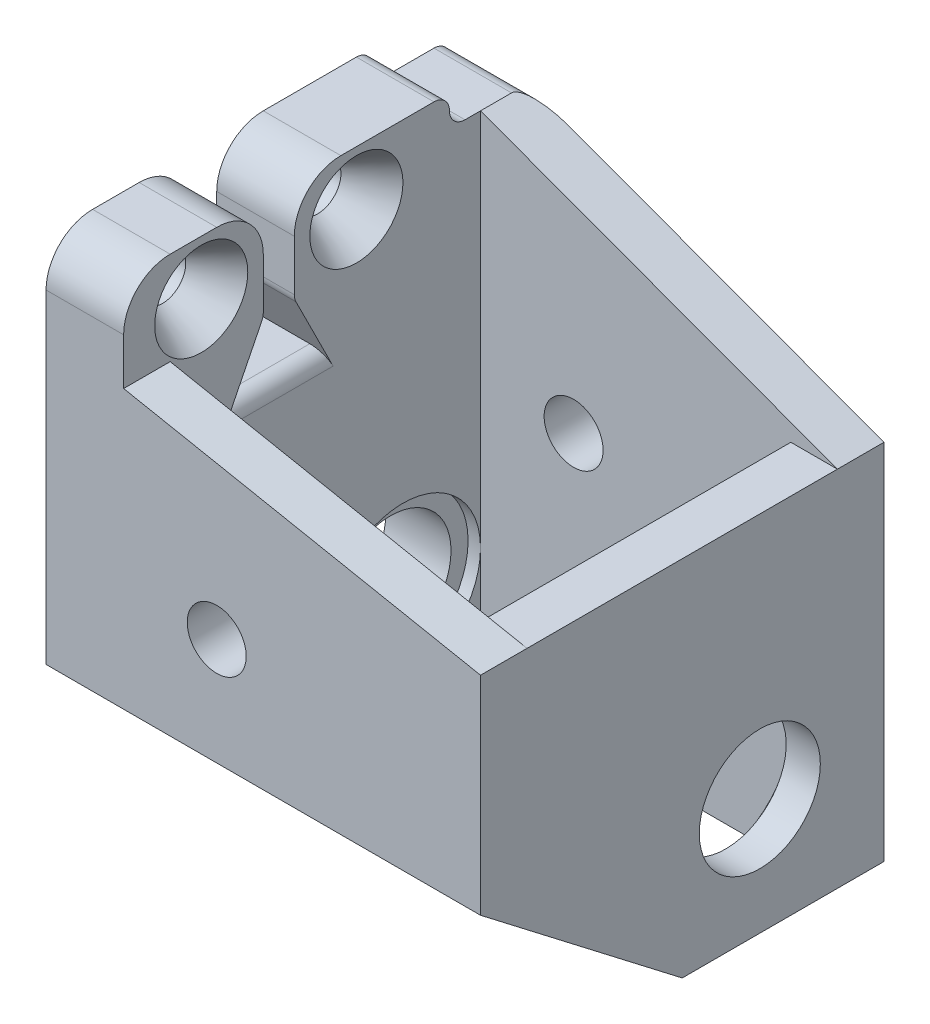
from build123d import *
from build123d.topology import SkipClean

# Parameters (mm, degrees)
SKETCH_1_W                = 20
SKETCH_1_H                = 57.76596942167697
EXTRUDE_1_DEPTH           = 3
EXTRUDE_2_DEPTH           = 3
CUT_EXTRUDE_1_DEPTH       = 6
SKETCH_8_R                = 4.48
CUT_EXTRUDE_2_DEPTH       = 0.8
SKETCH_9_R                = 1.9
CUT_EXTRUDE_3_DEPTH       = 3.8
SKETCH_12_W               = 26.000000000000007
SKETCH_12_H               = 35.36596942167698
CUT_EXTRUDE_4_DEPTH       = 36.00000000000001
CUT_EXTRUDE_8_DEPTH       = 28.00000000000001
SKETCH_23_W               = 26.000000000000004
SKETCH_23_H               = 26
SKETCH_23_W_2             = 20
SKETCH_23_H_2             = 19.999999999999993
EXTRUDE_7_DEPTH           = 4
SKETCH_24_W               = 20
SKETCH_24_H               = 19.999999999999993
EXTRUDE_8_DEPTH           = 3
SKETCH_25_W               = 5.000000000000002
SKETCH_25_H               = 16
SKETCH_25_R               = 1.4999999999999991
EXTRUDE_9_DEPTH           = 3
FILLET_1_R                = 1
CUT_EXTRUDE_9_DEPTH       = 3
SKETCH_27_R               = 1.4999999999999987
CUT_EXTRUDE_10_DEPTH      = 3
SKETCH_28_W               = 20
SKETCH_28_H               = 19.999999999999993
CUT_EXTRUDE_11_DEPTH      = 10
CUT_EXTRUDE_12_DEPTH      = 42.00000000000001
SKETCH_31_R               = 4.48
SKETCH_31_R_2             = 3.98
EXTRUDE_13_DEPTH          = 0.8
SKETCH_32_R               = 5.000000000000001
SKETCH_32_R_2             = 3.98
CUT_EXTRUDE_13_DEPTH      = 0.8
SKETCH_33_R               = 4.48
EXTRUDE_14_DEPTH          = 3
SKETCH_36_R               = 5.000000000000001
CUT_EXTRUDE_14_DEPTH      = 3
SKETCH_37_R               = 3.98
SKETCH_37_R_2             = 3.900000000000001
EXTRUDE_17_DEPTH          = 0.8
SKETCH_38_R               = 1.5000000000000009
EXTRUDE_18_DEPTH          = 3
SKETCH_39_W               = 4.187599959799879
SKETCH_39_H               = 1.3608825238343043
EXTRUDE_19_DEPTH          = 3
EXTRUDE_START             = 2
SKETCH_43_R               = 1.5000000000000024
SKETCH_43_R_2             = 1.5000000000000009
SKETCH_43_R_3             = 3.900000000000002
EXTRUDE_22_DEPTH          = 2
SKETCH_44_W               = 5
SKETCH_44_H               = 9.399224841629362
EXTRUDE_23_DEPTH          = 2
EXTRUDE_24_DEPTH          = 3
SKETCH_47_W               = 5
SKETCH_47_H               = 9.399224841629362
EXTRUDE_25_DEPTH          = 8
SKETCH_51_W               = 5
SKETCH_51_H               = 14
SKETCH_51_H_2             = 7.999999999999998
EXTRUDE_28_DEPTH          = 1.1
CUT_EXTRUDE_16_DEPTH      = 6.1000000000000005
FILLET_START              = -16
FILLET_9_DEPTH            = 7
FILLET_START_2            = -15
FILLET_9_2_DEPTH          = 5
EXTRUDE_30_DEPTH          = 3
FILLET_10_R               = 1
SKETCH_57_W               = 5
SKETCH_57_H               = 10.499224841629362
EXTRUDE_31_DEPTH          = 1
SKETCH_58_W               = 5
SKETCH_58_H               = 10.499224841629362
EXTRUDE_32_DEPTH          = 1
FILLET_11_R               = 3
CUT_EXTRUDE_19_DEPTH      = 6.500000000000001
FILLET_14_R               = 1
FILLET_19_R               = 1
HOLE_WIZARD_1_D           = 3
HOLE_WIZARD_1_DEPTH       = 5
HOLE_WIZARD_1_CSINK_D     = 6
HOLE_WIZARD_1_CSINK_ANGLE = 62


with BuildPart() as part:
    # 草图1 → 凸台-拉伸1 (new body)
    with BuildSketch(Plane.XY):
        with Locations((0, -28.882984710838485)):
            Rectangle(SKETCH_1_W, SKETCH_1_H)
    extrude_1 = extrude(amount=-EXTRUDE_1_DEPTH)

    # 草图2 → 凸台-拉伸2 (add)
    with BuildSketch(Plane.ZY.offset(10)):
        Polygon((-3, -1.22e-15), (23, 0), (23.000000000000007, -57.76596942167697), (-3, -57.76596942167697), align=None)
    extrude_2 = extrude(amount=EXTRUDE_2_DEPTH)

    # 草图7 → 切除-拉伸1 (cut)
    with BuildSketch(Plane(origin=(-10, 0, 0), x_dir=(0, 0, -1), z_dir=(1, 0, 0))):
        with BuildLine():
            ThreePointArc((-1.0999999999999996, -14.899999999999997), (-5, -10.999999999999996), (-8.9, -14.899999999999997))
            Line((-8.9, -14.899999999999997), (-1.1000000000000014, -14.899999999999997))
        make_face()
        with BuildLine():
            Line((-1.1000000000000014, -14.899999999999997), (-8.9, -14.899999999999997))
            ThreePointArc((-8.9, -14.899999999999997), (-5.000000000000001, -18.799999999999997), (-1.0999999999999996, -14.899999999999999))
        make_face()
    cut_extrude_1 = extrude(amount=-CUT_EXTRUDE_1_DEPTH, mode=Mode.SUBTRACT)

    # 草图8 → 切除-拉伸2 (cut)
    with BuildSketch(Plane.ZY.offset(13.000000000000002)):
        with Locations((5, -14.899999999999997)):
            Circle(SKETCH_8_R)
    cut_extrude_2 = extrude(amount=-CUT_EXTRUDE_2_DEPTH, mode=Mode.SUBTRACT)

    # 草图9 → 切除-拉伸3 (cut)
    with BuildSketch(Plane.XY):
        with Locations((-4, -5.499999999999998)):
            Circle(SKETCH_9_R)
    cut_extrude_3 = extrude(amount=-CUT_EXTRUDE_3_DEPTH, mode=Mode.SUBTRACT)

    # 镜向1: 凸台-拉伸2 across plane
    add(extrude_2.mirror(Plane(origin=(0, 0, 0), x_dir=(0, 0, 1), z_dir=(1, 0, 0))))

    # 镜向2: 切除-拉伸1, 切除-拉伸2 across plane
    add(cut_extrude_1.mirror(Plane(origin=(0, 0, 0), x_dir=(0, 0, 1), z_dir=(1, 0, 0))), mode=Mode.SUBTRACT)
    add(cut_extrude_2.mirror(Plane(origin=(0, 0, 0), x_dir=(0, 0, 1), z_dir=(1, 0, 0))), mode=Mode.SUBTRACT)

    # 镜向3: 凸台-拉伸1 across plane
    add(extrude_1.mirror(Plane.XY.offset(10)))

    # 镜向5: 切除-拉伸3 across plane
    add(cut_extrude_3.mirror(Plane.XY.offset(10)), mode=Mode.SUBTRACT)

    # 草图12 → 切除-拉伸4 (cut)
    with BuildSketch(Plane(origin=(13.000000000000002, 0, 0), x_dir=(0, 0, -1), z_dir=(1, 0, 0))):
        with Locations((-10.000000000000004, -40.08298471083848)):
            Rectangle(SKETCH_12_W, SKETCH_12_H)
    extrude(amount=-CUT_EXTRUDE_4_DEPTH, mode=Mode.SUBTRACT)

    # 草图22 → 切除-拉伸8 (cut)
    with BuildSketch(Plane(origin=(13.000000000000002, 0, 0), x_dir=(0, 0, -1), z_dir=(1, 0, 0))):
        Polygon((-23.000000000000007, -12.399999999999997), (-23.000000000000007, -22.399999999999995), (-10.000000000000007, -22.399999999999995), align=None)
    extrude(amount=-CUT_EXTRUDE_8_DEPTH, mode=Mode.SUBTRACT)

    # 草图23 → 凸台-拉伸7 (add)
    with BuildSketch(Plane(origin=(0, 0, 0), x_dir=(1, 0, 0), z_dir=(0, 1, 0))):
        with Locations((0, -10)):
            Rectangle(SKETCH_23_W, SKETCH_23_H)
        with Locations((0, -9.999999999999996)):
            Rectangle(SKETCH_23_W_2, SKETCH_23_H_2, mode=Mode.SUBTRACT)
    extrude(amount=EXTRUDE_7_DEPTH)

    # 草图24 → 凸台-拉伸8 (add)
    with BuildSketch(Plane(origin=(0, 4, 0), x_dir=(1, 0, 0), z_dir=(0, 1, 0))):
        with Locations((0, -9.999999999999996)):
            Rectangle(SKETCH_24_W, SKETCH_24_H)
    extrude(amount=-EXTRUDE_8_DEPTH)

    # 草图25 → 凸台-拉伸9 (add)
    with BuildSketch(Plane(origin=(0, 4, 0), x_dir=(1, 0, 0), z_dir=(0, 1, 0))):
        with Locations((15.500000000000004, -15)):
            Rectangle(SKETCH_25_W, SKETCH_25_H)
        with Locations(Location((15.500000000000002, -20.23329325648959, 0), (0, 0, 270))):
            Circle(SKETCH_25_R, mode=Mode.SUBTRACT)
        with Locations(Location((15.500000000000002, -10.23329325648959, 0), (0, 0, 270))):
            Circle(SKETCH_25_R, mode=Mode.SUBTRACT)
    extrude(amount=-EXTRUDE_9_DEPTH)

    # 圆角1
    fillet_1_edges = [part.edges().sort_by_distance(p)[0] for p in [
        (18.000000000000004, 1, 15),
    ]]
    fillet(fillet_1_edges, radius=FILLET_1_R)

    # 草图26 → 切除-拉伸9 (cut)
    with BuildSketch(Plane(origin=(13.000000000000002, 0, 0), x_dir=(0, 0, -1), z_dir=(1, 0, 0))):
        with BuildLine():
            Line((-16, 1.0000000000000004), (-13.999999999999998, 1.0000000000000004))
            ThreePointArc((-13.999999999999998, 1.0000000000000004), (-15, 0), (-16, 1.0000000000000004))
        make_face()
    extrude(amount=-CUT_EXTRUDE_9_DEPTH, mode=Mode.SUBTRACT)

    # 草图27 → 切除-拉伸10 (cut)
    with BuildSketch(Plane(origin=(0, 4, 0), x_dir=(1, 0, 0), z_dir=(0, 1, 0))):
        with Locations(Location((7.500000000000002, -15.233293256489592, 0), (0, 0, 270))):
            Circle(SKETCH_27_R)
    extrude(amount=-CUT_EXTRUDE_10_DEPTH, mode=Mode.SUBTRACT)

    # 草图28 → 切除-拉伸11 (cut)
    with BuildSketch(Plane.XZ.offset(-1)):
        with Locations((0, 9.999999999999996)):
            Rectangle(SKETCH_28_W, SKETCH_28_H)
    extrude(amount=-CUT_EXTRUDE_11_DEPTH, mode=Mode.SUBTRACT)

    # 草图29 → 切除-拉伸12 (cut)
    with BuildSketch(Plane(origin=(0, 0, -3), x_dir=(-1, 0, 0), z_dir=(0, 0, -1))):
        Polygon((13.000000000000002, 4), (-24.68163228941081, 4), (-24.68163228941081, 0.9999999999999957), (13.000000000000002, 1.0000000000000002), align=None)
    extrude(amount=-CUT_EXTRUDE_12_DEPTH, mode=Mode.SUBTRACT)

    # 草图31 → 凸台-拉伸13 (add)
    with BuildSketch(Plane.ZY.offset(12.200000000000001)):
        with Locations((5, -14.899999999999997)):
            Circle(SKETCH_31_R)
        with Locations((5, -14.899999999999997)):
            Circle(SKETCH_31_R_2, mode=Mode.SUBTRACT)
    extrude(amount=EXTRUDE_13_DEPTH)

    # 草图32 → 切除-拉伸13 (cut)
    with BuildSketch(Plane(origin=(-10, 0, 0), x_dir=(0, 0, -1), z_dir=(1, 0, 0))):
        with Locations((-5, -14.899999999999997)):
            Circle(SKETCH_32_R)
        with Locations(Location((-5, -14.899999999999997, 0), (0, 0, 180))):
            Circle(SKETCH_32_R_2, mode=Mode.SUBTRACT)
    cut_extrude_13 = extrude(amount=-CUT_EXTRUDE_13_DEPTH, mode=Mode.SUBTRACT)

    # 草图33 → 凸台-拉伸14 (add)
    with BuildSketch(Plane(origin=(13.000000000000002, 0, 0), x_dir=(0, 0, -1), z_dir=(1, 0, 0))):
        with Locations((-5, -14.899999999999997)):
            Circle(SKETCH_33_R)
    extrude(amount=-EXTRUDE_14_DEPTH)

    # 镜向6: 切除-拉伸1, 切除-拉伸13 across plane
    add(cut_extrude_1.mirror(Plane(origin=(0, 0, 0), x_dir=(0, 0, 1), z_dir=(1, 0, 0))), mode=Mode.SUBTRACT)
    add(cut_extrude_13.mirror(Plane(origin=(0, 0, 0), x_dir=(0, 0, 1), z_dir=(1, 0, 0))), mode=Mode.SUBTRACT)

    # 草图36 → 切除-拉伸14 (cut)
    with BuildSketch(Plane(origin=(-10.8, 0, 0), x_dir=(0, 0, -1), z_dir=(1, 0, 0))):
        with Locations((-5, -14.899999999999997)):
            Circle(SKETCH_36_R)
    cut_extrude_14 = extrude(amount=CUT_EXTRUDE_14_DEPTH, mode=Mode.SUBTRACT)

    # 镜向7: 切除-拉伸14 across plane
    add(cut_extrude_14.mirror(Plane(origin=(0, 0, 0), x_dir=(0, 0, 1), z_dir=(1, 0, 0))), mode=Mode.SUBTRACT)

    # 草图37 → 凸台-拉伸17 (add)
    with SkipClean():  # the faces are left unmerged after this step: merging them gives an invalid solid
        with BuildSketch(Plane.ZY.offset(12.200000000000001)):
            with Locations((5, -14.899999999999997)):
                Circle(SKETCH_37_R)
            with Locations((5, -14.899999999999997)):
                Circle(SKETCH_37_R_2, mode=Mode.SUBTRACT)
        extrude(amount=EXTRUDE_17_DEPTH)

    # 草图38 → 凸台-拉伸18 (add)
    # profile 1 of 2: a face of its own
    with SkipClean():  # the faces are left unmerged after this step: merging them gives an invalid solid
        with BuildSketch(Plane.ZY.offset(13.000000000000002)):
            Polygon((15, 10.399224841629362), (15, 1), (20.999999999999996, 1.0000000000000002), (20.999999999999996, 10.399224841629362), align=None)
            with Locations((18, 8)):
                Circle(SKETCH_38_R, mode=Mode.SUBTRACT)
        # profile 2 of 2: a face of its own
        with BuildSketch(Plane.ZY.offset(13.000000000000002)):
            Polygon((11, 1), (11, 10.399224841629362), (5.000000000000001, 10.399224841629362), (5.000000000000001, 1.0000000000000002), align=None)
            with Locations((8, 8)):
                Circle(SKETCH_38_R, mode=Mode.SUBTRACT)
        extrude(amount=-EXTRUDE_18_DEPTH)

    # 草图39 → 凸台-拉伸19 (add)
    with SkipClean():  # the faces are left unmerged after this step: merging them gives an invalid solid
        with BuildSketch(Plane(origin=(13.000000000000002, 0, 0), x_dir=(0, 0, -1), z_dir=(1, 0, 0))):
            with Locations((-15.28799119011226, 0.3195587380828476)):
                Rectangle(SKETCH_39_W, SKETCH_39_H)
        extrude(amount=-EXTRUDE_19_DEPTH)

    # 草图43 → 凸台-拉伸22 (add)
    with BuildSketch(Plane.ZY.offset(13.000000000000002).offset(EXTRUDE_START)):
        Polygon((-3, 1.0000000000000002), (5.000000000000004, 1.0000000000000002), (5.000000000000001, 10.399224841629362), (11, 10.399224841629362), (11, 1.0000000000000002), (15, 1.0000000000000002), (15, 10.399224841629362), (20.999999999999996, 10.399224841629362), (20.999999999999996, 1.0000000000000002), (23.000000000000007, 1.0000000000000002), (23.000000000000007, -12.399999999999997), (10.000000000000009, -22.399999999999995), (-3, -22.399999999999995), align=None)
        with Locations((8, 8)):
            Circle(SKETCH_43_R, mode=Mode.SUBTRACT)
        with Locations((18, 8)):
            Circle(SKETCH_43_R_2, mode=Mode.SUBTRACT)
        with Locations((5, -14.899999999999997)):
            Circle(SKETCH_43_R_3, mode=Mode.SUBTRACT)
    extrude(amount=-EXTRUDE_22_DEPTH)

    # 草图44 → 凸台-拉伸23 (add)
    with BuildSketch(Plane.XY.offset(20.999999999999996)):
        with Locations((-12.500000000000002, 5.699612420814681)):
            Rectangle(SKETCH_44_W, SKETCH_44_H)
    extrude(amount=EXTRUDE_23_DEPTH)

    # 草图45 → 凸台-拉伸24 (add)
    with BuildSketch(Plane.XY.offset(23)):
        Polygon((-10.000000000000002, 0.9999999999999981), (13.000000000000002, 0.9999999999999943), (-10.000000000000002, 5.499999999999998), align=None)
    extrude(amount=-EXTRUDE_24_DEPTH)

    # 草图47 → 凸台-拉伸25 (add)
    with BuildSketch(Plane(origin=(0, 0, 5.000000000000001), x_dir=(-1, 0, 0), z_dir=(0, 0, -1))):
        with Locations((12.500000000000002, 5.699612420814681)):
            Rectangle(SKETCH_47_W, SKETCH_47_H)
    extrude(amount=EXTRUDE_25_DEPTH)

    # 草图51 → 凸台-拉伸28 (add)
    with BuildSketch(Plane(origin=(0, 10.399224841629362, 0), x_dir=(1, 0, 0), z_dir=(0, 1, 0))):
        with Locations((-12.500000000000002, -4)):
            Rectangle(SKETCH_51_W, SKETCH_51_H)
        with Locations((-12.500000000000002, -19)):
            Rectangle(SKETCH_51_W, SKETCH_51_H_2)
    extrude(amount=EXTRUDE_28_DEPTH)

    # 草图53 → 切除-拉伸16 (cut)
    with BuildSketch(Plane(origin=(-10, 0, 0), x_dir=(0, 0, -1), z_dir=(1, 0, 0))):
        Polygon((2.999999999999999, 11.499224841629362), (-2.000000000000001, 11.499224841629362), (-2.0000000000000004, 9.49922484162936), (2.999999999999999, 9.499224841629362), align=None)
    extrude(amount=-CUT_EXTRUDE_16_DEPTH, mode=Mode.SUBTRACT)

    # 圆角9: read off the stored shape, not the designer's step
    # 圆角9 outline → 圆角9 (cut)
    with BuildSketch(Plane.YZ.offset(FILLET_START)):
        with BuildLine():
            Line((11.499224842, 2), (11.499224842, 3))
            ThreePointArc((11.499224842, 3), (11.206331623, 2.292893219), (10.499224842, 2))
            Line((10.499224842, 2), (11.499224842, 2))
        make_face()
    extrude(amount=FILLET_9_DEPTH, mode=Mode.SUBTRACT)

    # Fillet 9 2 outline → Fillet 9 2 (add)
    with BuildSketch(Plane.YZ.offset(FILLET_START_2)):
        with BuildLine():
            ThreePointArc((9.499224842, 1), (9.79211806, 1.707106782), (10.499224842, 2))
            Line((10.499224842, 2), (9.499224842, 2))
            Line((9.499224842, 2), (9.499224842, 1))
        make_face()
    extrude(amount=FILLET_9_2_DEPTH)

    # 草图54 → 凸台-拉伸30 (add)
    with BuildSketch(Plane(origin=(0, 0, -3), x_dir=(-1, 0, 0), z_dir=(0, 0, -1))):
        Polygon((-13.000000000000002, 0.9999999999999972), (10.000000000000002, 1.0000000000000002), (10, 9.499224841629362), align=None)
    extrude(amount=-EXTRUDE_30_DEPTH)

    # 圆角10
    fillet_10_edges = [part.edges().sort_by_distance(p)[0] for p in [
        (-12.5, 9.499224841629362, -2.999999999999999),
    ]]
    fillet(fillet_10_edges, radius=FILLET_10_R)

    # 草图57 → 凸台-拉伸31 (add)
    with BuildSketch(Plane(origin=(0, 0, 15), x_dir=(-1, 0, 0), z_dir=(0, 0, -1))):
        with Locations((12.500000000000002, 6.249612420814681)):
            Rectangle(SKETCH_57_W, SKETCH_57_H)
    extrude(amount=EXTRUDE_31_DEPTH)

    # 草图58 → 凸台-拉伸32 (add)
    with BuildSketch(Plane.XY.offset(11)):
        with Locations((-12.500000000000002, 6.249612420814681)):
            Rectangle(SKETCH_58_W, SKETCH_58_H)
    extrude(amount=EXTRUDE_32_DEPTH)

    # 圆角11
    # the kernel refuses this fillet: 3 mm, written as the material it takes off along each edge
    with BuildSketch(Plane(origin=(-2.5000000000000018, 11.499224841629362, 23), x_dir=(0, -1, 0), z_dir=(-1, 0, 0)), Plane(origin=(-2.5000000000000018, 11.499224841629362, 14), x_dir=(0, 0, 1), z_dir=(-1, 0, 0))) as fillet_11_piece_1:
        with BuildLine():
            CenterArc((FILLET_11_R, -FILLET_11_R), FILLET_11_R, 90, 90)
            Line((0, -FILLET_11_R), (0, 0))
            Line((0, 0), (FILLET_11_R, 0))
        make_face()
    extrude(amount=20, mode=Mode.SUBTRACT)
    with BuildSketch(Plane(origin=(-22.5, 11.499224841629362, 12), x_dir=(0, -1, 0), z_dir=(1, 0, 0))) as fillet_11_piece_2:
        with BuildLine():
            CenterArc((FILLET_11_R, FILLET_11_R), FILLET_11_R, 180, 90)
            Line((0, FILLET_11_R), (0, 0))
            Line((0, 0), (FILLET_11_R, 0))
        make_face()
    extrude(amount=20, mode=Mode.SUBTRACT)

    # 草图61 → 切除-拉伸19 (cut)
    with BuildSketch(Plane(origin=(-10, 0, 0), x_dir=(0, 0, -1), z_dir=(1, 0, 0))):
        Polygon((-12, 1.0000000000000002), (-12, 5), (-10, 1.0000000000000007), align=None)
        Polygon((-13.999999999999998, 1.0000000000000002), (-13.999999999999998, 5), (-16, 0.9999999999999998), align=None)
    extrude(amount=-CUT_EXTRUDE_19_DEPTH, mode=Mode.SUBTRACT)

    # 圆角14
    fillet_14_edges = [part.edges().sort_by_distance(p)[0] for p in [
        (-10, 1.0000000000000002, 13),
    ]]
    fillet(fillet_14_edges, radius=FILLET_14_R)

    # 圆角19
    fillet_19_edges = [part.edges().sort_by_distance(p)[0] for p in [
        (-12.5, 5, 12),
        (-12.5, 5, 13.999999999999998),
    ]]
    fillet(fillet_19_edges, radius=FILLET_19_R)

    # 打孔尺寸(%根据)内六角花形沉头螺钉的类型1
    with Locations(Plane(origin=(-10, 8, 18), x_dir=(0, 0, 1), z_dir=(1, 0, 0))):
        with Locations((0, 0), (-10, 0)):
            CounterSinkHole(HOLE_WIZARD_1_D / 2, HOLE_WIZARD_1_CSINK_D / 2, depth=HOLE_WIZARD_1_DEPTH, counter_sink_angle=HOLE_WIZARD_1_CSINK_ANGLE)


solid = part.part
